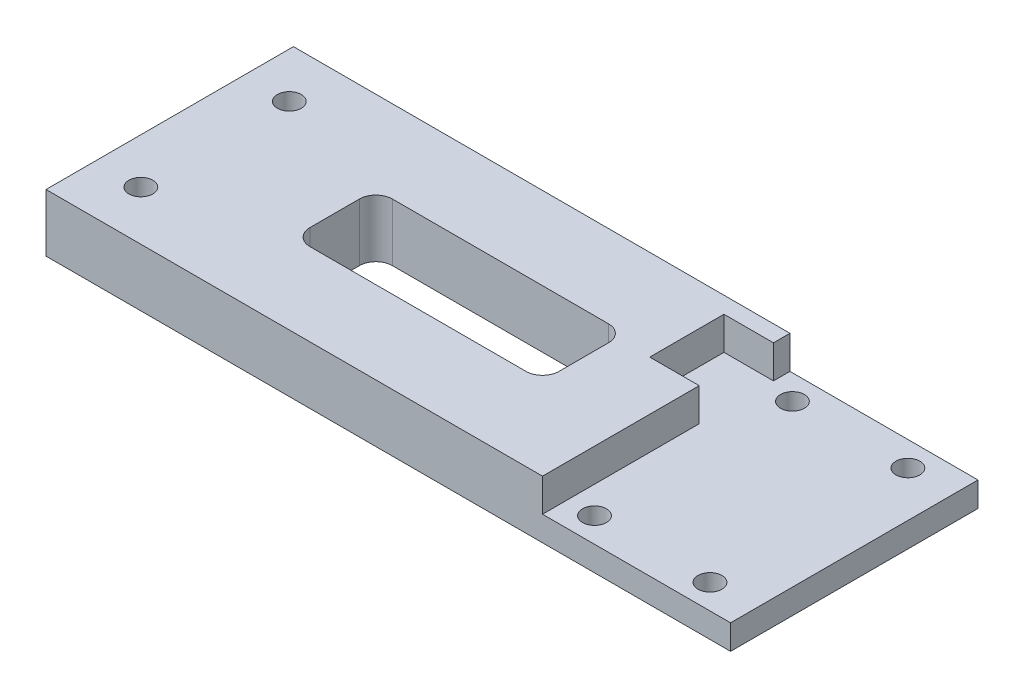
from build123d import *

# Parameters (mm, degrees)
SKETCH_1_W          = 88
SKETCH_1_H          = 30
EXTRUDE_1_DEPTH     = 3
SKETCH_2_W          = 27.8
SKETCH_2_H          = 30
CUT_EXTRUDE_1_DEPTH = 1
SKETCH_3_R          = 1.45
CUT_EXTRUDE_2_DEPTH = 11
SKETCH_4_R          = 1.45
CUT_EXTRUDE_4_DEPTH = 11
SKETCH_5_W          = 30.2
SKETCH_5_H          = 10
CUT_EXTRUDE_5_DEPTH = 11
FILLET_1_R          = 2
SKETCH_6_W          = 5
SKETCH_6_H          = 30
CUT_EXTRUDE_6_DEPTH = 10
SKETCH_9_W          = 60.2
SKETCH_9_H          = 30
SKETCH_9_R          = 1.45
EXTRUDE_4_DEPTH     = 4
EXTRUDE_START       = 1
SKETCH_7_W          = 22.8
SKETCH_7_H          = 30
SKETCH_7_R          = 1.45
EXTRUDE_5_DEPTH     = 1
SKETCH_11_W         = 15
SKETCH_11_H         = 4
CUT_EXTRUDE_8_DEPTH = 6
SKETCH_12_W         = 2
SKETCH_12_H         = 4
EXTRUDE_6_DEPTH     = 6
SKETCH_13_W         = 6
SKETCH_13_H         = 4
EXTRUDE_7_DEPTH     = 4
SKETCH_14_R         = 4
CUT_EXTRUDE_9_DEPTH = 4


with BuildPart() as part:
    # 草图1 → 凸台-拉伸1 (new body)
    with BuildSketch(Plane(origin=(0, 0, 0), x_dir=(1, 0, 0), z_dir=(0, 1, 0))):
        with Locations((-44, 15)):
            Rectangle(SKETCH_1_W, SKETCH_1_H)
    extrude(amount=EXTRUDE_1_DEPTH)

    # 草图2 → 切除-拉伸1 (cut)
    with BuildSketch(Plane(origin=(0, 3, 0), x_dir=(1, 0, 0), z_dir=(0, 1, 0))):
        with Locations((-13.9, 15)):
            Rectangle(SKETCH_2_W, SKETCH_2_H)
    extrude(amount=-CUT_EXTRUDE_1_DEPTH, mode=Mode.SUBTRACT)

    # 草图3 → 切除-拉伸2 (cut)
    with BuildSketch(Plane(origin=(0, 2, 0), x_dir=(1, 0, 0), z_dir=(0, 1, 0))):
        with Locations((-24.5, 27)):
            Circle(SKETCH_3_R)
        with Locations((-24.5, 3)):
            Circle(SKETCH_3_R)
        with Locations((-10.5, 3)):
            Circle(SKETCH_3_R)
        with Locations((-10.5, 27)):
            Circle(SKETCH_3_R)
    extrude(amount=-CUT_EXTRUDE_2_DEPTH, mode=Mode.SUBTRACT)

    # 草图4 → 切除-拉伸4 (cut)
    with BuildSketch(Plane(origin=(0, 3, 0), x_dir=(1, 0, 0), z_dir=(0, 1, 0))):
        with Locations((-82.5, 24)):
            Circle(SKETCH_4_R)
        with Locations((-82.5, 6)):
            Circle(SKETCH_4_R)
    extrude(amount=-CUT_EXTRUDE_4_DEPTH, mode=Mode.SUBTRACT)

    # 草图5 → 切除-拉伸5 (cut)
    with BuildSketch(Plane(origin=(0, 3, 0), x_dir=(1, 0, 0), z_dir=(0, 1, 0))):
        with Locations((-52.9, 15)):
            Rectangle(SKETCH_5_W, SKETCH_5_H)
    extrude(amount=-CUT_EXTRUDE_5_DEPTH, mode=Mode.SUBTRACT)

    # 圆角1
    fillet_1_edges = [part.edges().sort_by_distance(p)[0] for p in [
        (-68, 1.5, -10),
        (-37.8, 1.5, -10),
        (-37.8, 1.5, -20),
        (-68, 1.5, -20),
    ]]
    fillet(fillet_1_edges, radius=FILLET_1_R)

    # 草图6 → 切除-拉伸6 (cut)
    with BuildSketch(Plane.XZ):
        with Locations((-2.5, -15)):
            Rectangle(SKETCH_6_W, SKETCH_6_H)
    extrude(amount=-CUT_EXTRUDE_6_DEPTH, mode=Mode.SUBTRACT)

    # 草图9 → 凸台-拉伸4 (add)
    with BuildSketch(Plane(origin=(0, 3, 0), x_dir=(1, 0, 0), z_dir=(0, 1, 0))):
        with Locations((-57.9, 15)):
            Rectangle(SKETCH_9_W, SKETCH_9_H)
        with Locations((-82.5, 6)):
            Circle(SKETCH_9_R, mode=Mode.SUBTRACT)
        with Locations((-82.5, 24)):
            Circle(SKETCH_9_R, mode=Mode.SUBTRACT)
        with BuildLine():
            Line((-37.8, 12), (-37.8, 18))
            ThreePointArc((-37.8, 18), (-38.385786438, 19.414213562), (-39.8, 20))
            Line((-39.8, 20), (-66, 20))
            ThreePointArc((-66, 20), (-67.414213562, 19.414213562), (-68, 18))
            Line((-68, 18), (-68, 12))
            ThreePointArc((-68, 12), (-67.414213562, 10.585786438), (-66, 10))
            Line((-66, 10), (-39.8, 10))
            ThreePointArc((-39.8, 10), (-38.385786438, 10.585786438), (-37.8, 12))
        make_face(mode=Mode.SUBTRACT)
    extrude(amount=EXTRUDE_4_DEPTH)

    # 草图7 → 凸台-拉伸5 (add)
    with BuildSketch(Plane(origin=(0, 2, 0), x_dir=(1, 0, 0), z_dir=(0, 1, 0)).offset(EXTRUDE_START)):
        with Locations((-16.4, 15)):
            Rectangle(SKETCH_7_W, SKETCH_7_H)
        with Locations((-10.5, 3)):
            Circle(SKETCH_7_R, mode=Mode.SUBTRACT)
        with Locations((-24.5, 27)):
            Circle(SKETCH_7_R, mode=Mode.SUBTRACT)
        with Locations((-10.5, 27)):
            Circle(SKETCH_7_R, mode=Mode.SUBTRACT)
        with Locations((-24.5, 3)):
            Circle(SKETCH_7_R, mode=Mode.SUBTRACT)
    extrude(amount=-EXTRUDE_5_DEPTH)

    # 草图11 → 切除-拉伸8 (cut)
    with BuildSketch(Plane(origin=(-27.8, 0, 0), x_dir=(0, 0, -1), z_dir=(1, 0, 0))):
        with Locations((22.5, 5)):
            Rectangle(SKETCH_11_W, SKETCH_11_H)
    extrude(amount=-CUT_EXTRUDE_8_DEPTH, mode=Mode.SUBTRACT)

    # 草图12 → 凸台-拉伸6 (add)
    with BuildSketch(Plane(origin=(-33.8, 0, 0), x_dir=(0, 0, -1), z_dir=(1, 0, 0))):
        with Locations((29, 5)):
            Rectangle(SKETCH_12_W, SKETCH_12_H)
    extrude(amount=EXTRUDE_6_DEPTH)

    # 草图13 → 凸台-拉伸7 (add)
    with BuildSketch(Plane(origin=(0, 0, -15), x_dir=(-1, 0, 0), z_dir=(0, 0, -1))):
        with Locations((30.8, 5)):
            Rectangle(SKETCH_13_W, SKETCH_13_H)
    extrude(amount=EXTRUDE_7_DEPTH)

    # 草图14 → 切除-拉伸9 (cut)
    with BuildSketch(Plane.XZ):
        with Locations((-82.5, -6)):
            Circle(SKETCH_14_R)
        with Locations((-82.5, -24)):
            Circle(SKETCH_14_R)
    extrude(amount=-CUT_EXTRUDE_9_DEPTH, mode=Mode.SUBTRACT)


solid = part.part
